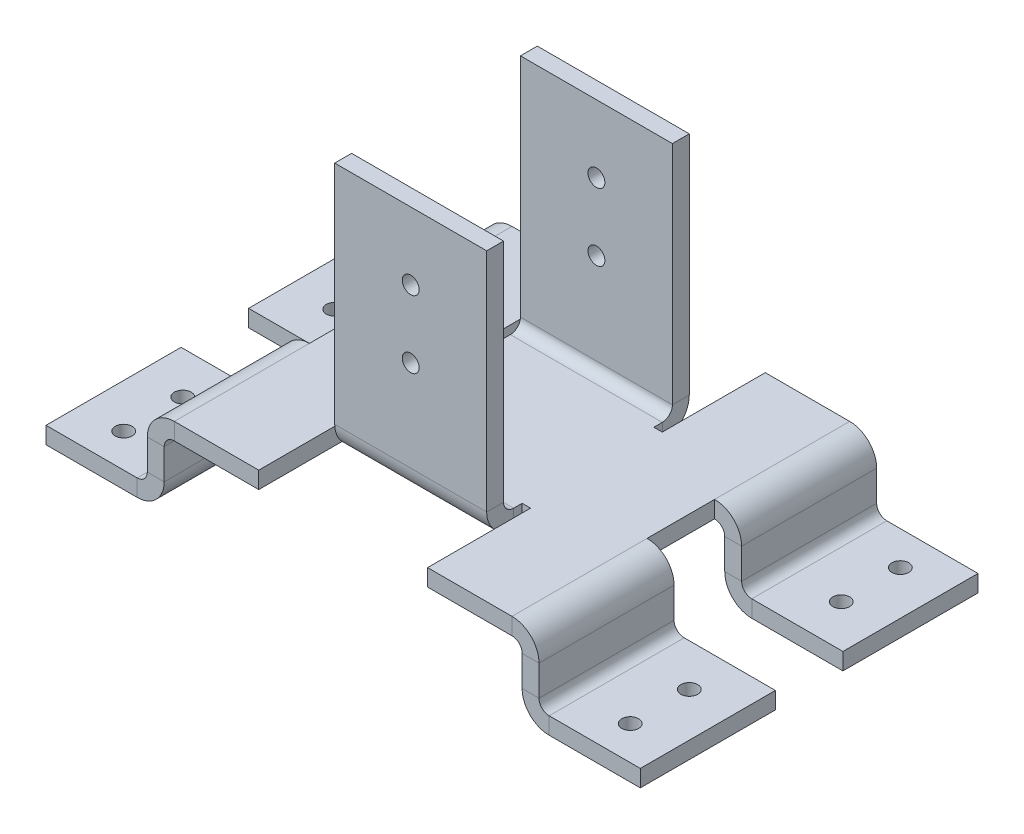
from build123d import *

# Parameters (mm, degrees)
SM_BASE_FLANGE_1_DEPTH            = 5
SM_EDGE_FLANGE_1_STRIP_W          = 26
SM_EDGE_FLANGE_1_STRIP_H          = 5
SM_EDGE_FLANGE_1_STRIP_CUT_DEPTH  = 45
SM_EDGE_FLANGE_1_RELIEF_W         = 28.5
SM_EDGE_FLANGE_1_RELIEF_H         = 2.5
SM_EDGE_FLANGE_1_RELIEF_CUT_DEPTH = 5
SM_EDGE_FLANGE_1_DEPTH            = 45
SM_EDGE_FLANGE_2_STRIP_W          = 26
SM_EDGE_FLANGE_2_STRIP_H          = 5
SM_EDGE_FLANGE_2_STRIP_CUT_DEPTH  = 45
SM_EDGE_FLANGE_2_RELIEF_W         = 28.5
SM_EDGE_FLANGE_2_RELIEF_H         = 2.5
SM_EDGE_FLANGE_2_RELIEF_CUT_DEPTH = 5
SM_EDGE_FLANGE_2_DEPTH            = 45
SM_EDGE_FLANGE_14_DEPTH           = 40
SM_EDGE_FLANGE_15_DEPTH           = 40
SM_EDGE_FLANGE_16_DEPTH           = 40
SM_EDGE_FLANGE_17_DEPTH           = 40
SM_EDGE_FLANGE_18_STRIP_W         = 26
SM_EDGE_FLANGE_18_STRIP_H         = 5
SM_EDGE_FLANGE_18_STRIP_CUT_DEPTH = 40
SM_EDGE_FLANGE_18_DEPTH           = 40
SM_EDGE_FLANGE_19_STRIP_W         = 26
SM_EDGE_FLANGE_19_STRIP_H         = 5
SM_EDGE_FLANGE_19_STRIP_CUT_DEPTH = 40
SM_EDGE_FLANGE_19_DEPTH           = 40
SM_EDGE_FLANGE_20_STRIP_W         = 26
SM_EDGE_FLANGE_20_STRIP_H         = 5
SM_EDGE_FLANGE_20_STRIP_CUT_DEPTH = 40
SM_EDGE_FLANGE_20_DEPTH           = 40
SM_EDGE_FLANGE_21_STRIP_W         = 26
SM_EDGE_FLANGE_21_STRIP_H         = 5
SM_EDGE_FLANGE_21_STRIP_CUT_DEPTH = 40
SM_EDGE_FLANGE_21_DEPTH           = 40
CUT_EXTRUDE_START                 = -25
SKETCH_80_R                       = 2.5
CUT_EXTRUDE_1_DEPTH               = 5
CUT_EXTRUDE_3_DEPTH               = 124.060960503
CUT_EXTRUDE_3_DEPTH_BACK          = 124.060960503
SKETCH_83_R                       = 2.5
CUT_EXTRUDE_START_2               = -20
SKETCH_84_R                       = 2.5
CUT_EXTRUDE_5_DEPTH               = 5


# Sheet-metal steps are written as plain solids
with BuildPart() as part:
    # Sketch 1 → 基体-法兰1 (new body)
    with BuildSketch(Plane(origin=(0, 0, 0), x_dir=(1, 0, 0), z_dir=(0, 1, 0))):
        Polygon((-25, -25), (-25, -50), (-50, -50), (-50, 50), (-25, 50), (-25, 25), (25, 25), (25, 50), (50, 50), (50, -50), (25, -50), (25, -25), align=None)
    extrude(amount=-SM_BASE_FLANGE_1_DEPTH)

    # 边线-法兰1 strip (across the edge) → 边线-法兰1 strip cut (cut)
    with BuildSketch(Plane(origin=(22.5, 0, -25), x_dir=(0, 0, 1), z_dir=(-1, 0, 0))):
        with Locations((-10, -2.5)):
            Rectangle(SM_EDGE_FLANGE_1_STRIP_W, SM_EDGE_FLANGE_1_STRIP_H)
    extrude(amount=SM_EDGE_FLANGE_1_STRIP_CUT_DEPTH, mode=Mode.SUBTRACT)

    # 边线-法兰1 relief (on the sheet) → 边线-法兰1 relief cut (cut)
    with BuildSketch(Plane(origin=(22.5, 0, -22), x_dir=(0, 0, 1), z_dir=(0, 1, 0))):
        with Locations((-11.75, 1.25)):
            Rectangle(SM_EDGE_FLANGE_1_RELIEF_W, SM_EDGE_FLANGE_1_RELIEF_H)
        with Locations((-11.75, -46.25)):
            Rectangle(SM_EDGE_FLANGE_1_RELIEF_W, SM_EDGE_FLANGE_1_RELIEF_H)
    extrude(amount=-SM_EDGE_FLANGE_1_RELIEF_CUT_DEPTH, mode=Mode.SUBTRACT)

    # 边线-法兰1 section (across the edge) → 边线-法兰1 (add)
    with BuildSketch(Plane(origin=(22.5, 0, -25), x_dir=(0, 0, 1), z_dir=(-1, 0, 0))):
        with BuildLine():
            Line((-5, 3), (-5, 70))
            Line((-5, 70), (0, 70))
            Line((0, 70), (0, 3))
            ThreePointArc((0, 3), (0.878679656, 0.878679656), (3, 0))
            Line((3, 0), (3, -5))
            ThreePointArc((3, -5), (-2.656854249, -2.656854249), (-5, 3))
        make_face()
    extrude(amount=SM_EDGE_FLANGE_1_DEPTH)

    # 边线-法兰2 strip (across the edge) → 边线-法兰2 strip cut (cut)
    with BuildSketch(Plane(origin=(-22.5, 0, 25), x_dir=(0, 0, -1), z_dir=(1, 0, 0))):
        with Locations((-10, -2.5)):
            Rectangle(SM_EDGE_FLANGE_2_STRIP_W, SM_EDGE_FLANGE_2_STRIP_H)
    extrude(amount=SM_EDGE_FLANGE_2_STRIP_CUT_DEPTH, mode=Mode.SUBTRACT)

    # 边线-法兰2 relief (on the sheet) → 边线-法兰2 relief cut (cut)
    with BuildSketch(Plane(origin=(-22.5, 0, 22), x_dir=(0, 0, -1), z_dir=(0, 1, 0))):
        with Locations((-11.75, 1.25)):
            Rectangle(SM_EDGE_FLANGE_2_RELIEF_W, SM_EDGE_FLANGE_2_RELIEF_H)
        with Locations((-11.75, -46.25)):
            Rectangle(SM_EDGE_FLANGE_2_RELIEF_W, SM_EDGE_FLANGE_2_RELIEF_H)
    extrude(amount=-SM_EDGE_FLANGE_2_RELIEF_CUT_DEPTH, mode=Mode.SUBTRACT)

    # 边线-法兰2 section (across the edge) → 边线-法兰2 (add)
    with BuildSketch(Plane(origin=(-22.5, 0, 25), x_dir=(0, 0, -1), z_dir=(1, 0, 0))):
        with BuildLine():
            Line((-5, 3), (-5, 70))
            Line((-5, 70), (0, 70))
            Line((0, 70), (0, 3))
            ThreePointArc((0, 3), (0.878679656, 0.878679656), (3, 0))
            Line((3, 0), (3, -5))
            ThreePointArc((3, -5), (-2.656854249, -2.656854249), (-5, 3))
        make_face()
    extrude(amount=SM_EDGE_FLANGE_2_DEPTH)

    # 边线-法兰14 section (across the edge) → 边线-法兰14 (add)
    with BuildSketch(Plane(origin=(53, -5, 10), x_dir=(-1, 0, 0), z_dir=(0, 0, 1))):
        with BuildLine():
            Line((-5, 3), (-5, 20))
            Line((-5, 20), (0, 20))
            Line((0, 20), (0, 3))
            ThreePointArc((0, 3), (0.878679656, 0.878679656), (3, 0))
            Line((3, 0), (3, -5))
            ThreePointArc((3, -5), (-2.656854249, -2.656854249), (-5, 3))
        make_face()
    extrude(amount=SM_EDGE_FLANGE_14_DEPTH)

    # 边线-法兰15 section (across the edge) → 边线-法兰15 (add)
    with BuildSketch(Plane(origin=(53, -5, -50), x_dir=(-1, 0, 0), z_dir=(0, 0, 1))):
        with BuildLine():
            Line((-5, 3), (-5, 20))
            Line((-5, 20), (0, 20))
            Line((0, 20), (0, 3))
            ThreePointArc((0, 3), (0.878679656, 0.878679656), (3, 0))
            Line((3, 0), (3, -5))
            ThreePointArc((3, -5), (-2.656854249, -2.656854249), (-5, 3))
        make_face()
    extrude(amount=SM_EDGE_FLANGE_15_DEPTH)

    # 边线-法兰16 section (across the edge) → 边线-法兰16 (add)
    with BuildSketch(Plane(origin=(-53, -5, -10), x_dir=(1, 0, 0), z_dir=(0, 0, -1))):
        with BuildLine():
            Line((-5, 3), (-5, 20))
            Line((-5, 20), (0, 20))
            Line((0, 20), (0, 3))
            ThreePointArc((0, 3), (0.878679656, 0.878679656), (3, 0))
            Line((3, 0), (3, -5))
            ThreePointArc((3, -5), (-2.656854249, -2.656854249), (-5, 3))
        make_face()
    extrude(amount=SM_EDGE_FLANGE_16_DEPTH)

    # 边线-法兰17 section (across the edge) → 边线-法兰17 (add)
    with BuildSketch(Plane(origin=(-53, -5, 50), x_dir=(1, 0, 0), z_dir=(0, 0, -1))):
        with BuildLine():
            Line((-5, 3), (-5, 20))
            Line((-5, 20), (0, 20))
            Line((0, 20), (0, 3))
            ThreePointArc((0, 3), (0.878679656, 0.878679656), (3, 0))
            Line((3, 0), (3, -5))
            ThreePointArc((3, -5), (-2.656854249, -2.656854249), (-5, 3))
        make_face()
    extrude(amount=SM_EDGE_FLANGE_17_DEPTH)

    # 边线-法兰18 strip (across the edge) → 边线-法兰18 strip cut (cut)
    with BuildSketch(Plane(origin=(-58, -25, -50), x_dir=(0, 1, 0), z_dir=(0, 0, 1))):
        with Locations((-5, -2.5)):
            Rectangle(SM_EDGE_FLANGE_18_STRIP_W, SM_EDGE_FLANGE_18_STRIP_H)
    extrude(amount=SM_EDGE_FLANGE_18_STRIP_CUT_DEPTH, mode=Mode.SUBTRACT)

    # 边线-法兰18 section (across the edge) → 边线-法兰18 (add)
    with BuildSketch(Plane(origin=(-58, -25, -50), x_dir=(0, 1, 0), z_dir=(0, 0, 1))):
        with BuildLine():
            Line((0, 3), (0, 30))
            Line((0, 30), (5, 30))
            Line((5, 30), (5, 3))
            ThreePointArc((5, 3), (5.878679656, 0.878679656), (8, 0))
            Line((8, 0), (8, -5))
            ThreePointArc((8, -5), (2.343145751, -2.656854249), (0, 3))
        make_face()
    extrude(amount=SM_EDGE_FLANGE_18_DEPTH)

    # 边线-法兰19 strip (across the edge) → 边线-法兰19 strip cut (cut)
    with BuildSketch(Plane(origin=(-58, -25, 10), x_dir=(0, 1, 0), z_dir=(0, 0, 1))):
        with Locations((-5, -2.5)):
            Rectangle(SM_EDGE_FLANGE_19_STRIP_W, SM_EDGE_FLANGE_19_STRIP_H)
    extrude(amount=SM_EDGE_FLANGE_19_STRIP_CUT_DEPTH, mode=Mode.SUBTRACT)

    # 边线-法兰19 section (across the edge) → 边线-法兰19 (add)
    with BuildSketch(Plane(origin=(-58, -25, 10), x_dir=(0, 1, 0), z_dir=(0, 0, 1))):
        with BuildLine():
            Line((0, 3), (0, 30))
            Line((0, 30), (5, 30))
            Line((5, 30), (5, 3))
            ThreePointArc((5, 3), (5.878679656, 0.878679656), (8, 0))
            Line((8, 0), (8, -5))
            ThreePointArc((8, -5), (2.343145751, -2.656854249), (0, 3))
        make_face()
    extrude(amount=SM_EDGE_FLANGE_19_DEPTH)

    # 边线-法兰20 strip (across the edge) → 边线-法兰20 strip cut (cut)
    with BuildSketch(Plane(origin=(58, -25, 50), x_dir=(0, 1, 0), z_dir=(0, 0, -1))):
        with Locations((-5, -2.5)):
            Rectangle(SM_EDGE_FLANGE_20_STRIP_W, SM_EDGE_FLANGE_20_STRIP_H)
    extrude(amount=SM_EDGE_FLANGE_20_STRIP_CUT_DEPTH, mode=Mode.SUBTRACT)

    # 边线-法兰20 section (across the edge) → 边线-法兰20 (add)
    with BuildSketch(Plane(origin=(58, -25, 50), x_dir=(0, 1, 0), z_dir=(0, 0, -1))):
        with BuildLine():
            Line((0, 3), (0, 30))
            Line((0, 30), (5, 30))
            Line((5, 30), (5, 3))
            ThreePointArc((5, 3), (5.878679656, 0.878679656), (8, 0))
            Line((8, 0), (8, -5))
            ThreePointArc((8, -5), (2.343145751, -2.656854249), (0, 3))
        make_face()
    extrude(amount=SM_EDGE_FLANGE_20_DEPTH)

    # 边线-法兰21 strip (across the edge) → 边线-法兰21 strip cut (cut)
    with BuildSketch(Plane(origin=(58, -25, -10), x_dir=(0, 1, 0), z_dir=(0, 0, -1))):
        with Locations((-5, -2.5)):
            Rectangle(SM_EDGE_FLANGE_21_STRIP_W, SM_EDGE_FLANGE_21_STRIP_H)
    extrude(amount=SM_EDGE_FLANGE_21_STRIP_CUT_DEPTH, mode=Mode.SUBTRACT)

    # 边线-法兰21 section (across the edge) → 边线-法兰21 (add)
    with BuildSketch(Plane(origin=(58, -25, -10), x_dir=(0, 1, 0), z_dir=(0, 0, -1))):
        with BuildLine():
            Line((0, 3), (0, 30))
            Line((0, 30), (5, 30))
            Line((5, 30), (5, 3))
            ThreePointArc((5, 3), (5.878679656, 0.878679656), (8, 0))
            Line((8, 0), (8, -5))
            ThreePointArc((8, -5), (2.343145751, -2.656854249), (0, 3))
        make_face()
    extrude(amount=SM_EDGE_FLANGE_21_DEPTH)

    # 草图80 → 切除-拉伸1 (cut)
    with BuildSketch(Plane(origin=(0, 0, 0), x_dir=(1, 0, 0), z_dir=(0, 1, 0)).offset(CUT_EXTRUDE_START)):
        with Locations(Location((-75, 40, 0), (0, 0, 270))):
            Circle(SKETCH_80_R)
        with Locations(Location((75, 40, 0), (0, 0, 270))):
            Circle(SKETCH_80_R)
        with Locations(Location((-75, -40, 0), (0, 0, 270))):
            Circle(SKETCH_80_R)
        with Locations(Location((75, -40, 0), (0, 0, 270))):
            Circle(SKETCH_80_R)
    extrude(amount=CUT_EXTRUDE_1_DEPTH, mode=Mode.SUBTRACT)

    # 草图83 → 切除-拉伸3 (cut, two sides: drawn at the far end of the back side and taken through both)
    with BuildSketch(Plane.XY.offset(-CUT_EXTRUDE_3_DEPTH_BACK)):
        with Locations((0, 50)):
            Circle(SKETCH_83_R)
        with Locations((0, 30)):
            Circle(SKETCH_83_R)
    extrude(amount=CUT_EXTRUDE_3_DEPTH + CUT_EXTRUDE_3_DEPTH_BACK, mode=Mode.SUBTRACT)

    # 草图84 → 切除-拉伸5 (cut)
    with BuildSketch(Plane(origin=(0, 0, 0), x_dir=(1, 0, 0), z_dir=(0, 1, 0)).offset(CUT_EXTRUDE_START_2)):
        with Locations(Location((75, 22.5, 0), (0, 0, 270))):
            Circle(SKETCH_84_R)
        with Locations(Location((75, -22.5, 0), (0, 0, 270))):
            Circle(SKETCH_84_R)
        with Locations(Location((-75, -22.5, 0), (0, 0, 270))):
            Circle(SKETCH_84_R)
        with Locations(Location((-75, 22.5, 0), (0, 0, 270))):
            Circle(SKETCH_84_R)
    extrude(amount=-CUT_EXTRUDE_5_DEPTH, mode=Mode.SUBTRACT)


solid = part.part
